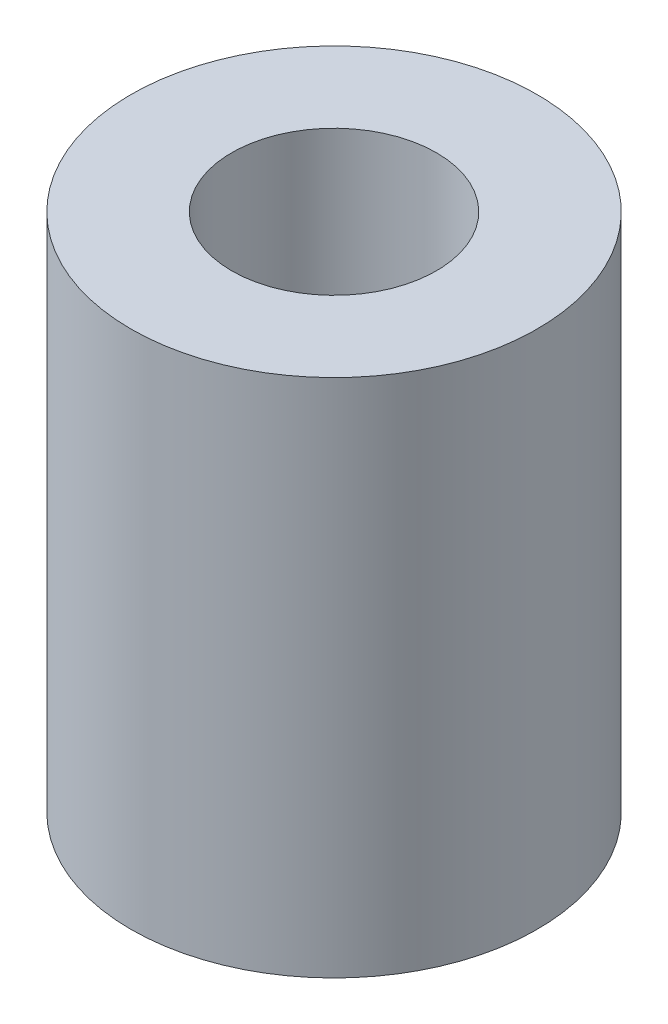
from build123d import *

# Parameters (mm, degrees)
SKETCH1_R           = 7.9375
BOSS_EXTRUDE1_DEPTH = 20.32
SKETCH3_R           = 4
CUT_EXTRUDE2_DEPTH  = 24.214439741


with BuildPart() as part:
    # Sketch1 → Boss-Extrude1 (new body)
    with BuildSketch(Plane(origin=(0, 0, 0), x_dir=(1, 0, 0), z_dir=(0, 1, 0))):
        Circle(SKETCH1_R)
    extrude(amount=BOSS_EXTRUDE1_DEPTH)

    # Sketch3 → Cut-Extrude2 (cut, through all)
    with BuildSketch(Plane(origin=(0, 20.32, 0), x_dir=(1, 0, 0), z_dir=(0, 1, 0))):
        Circle(SKETCH3_R)
    extrude(amount=-CUT_EXTRUDE2_DEPTH, mode=Mode.SUBTRACT)


solid = part.part
